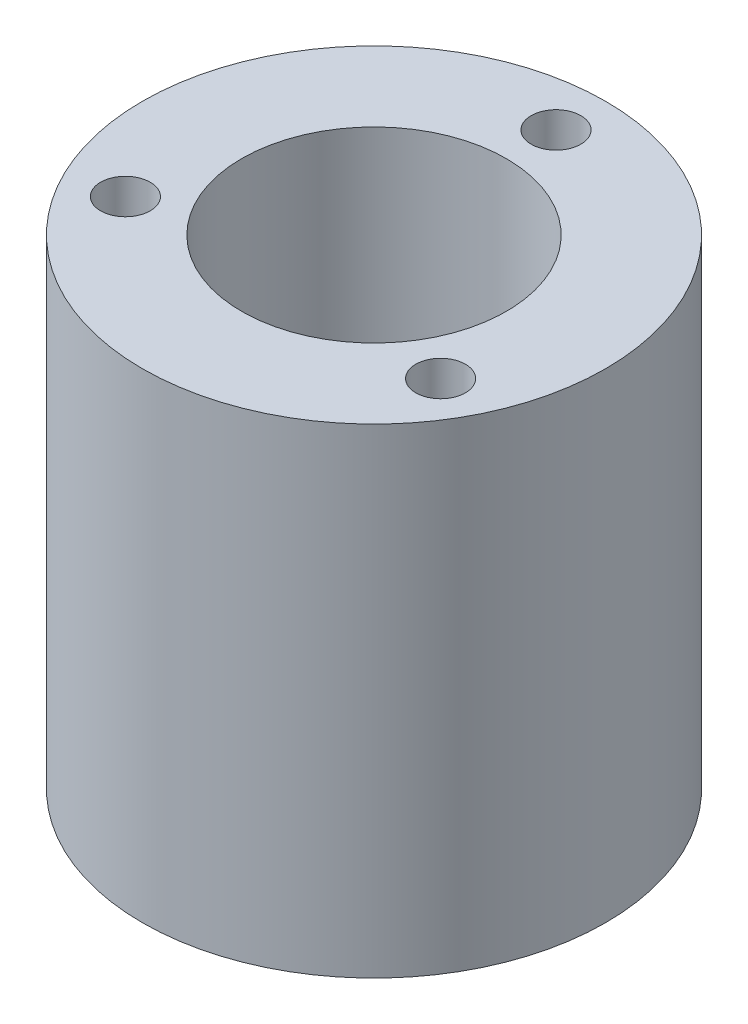
from build123d import *

# Parameters (mm, degrees)
ESQUISSE2_R             = 1.5
ENL_V_MAT_EXTRU_1_DEPTH = 10
ESQUISSE3_R             = 8
ENL_V_MAT_EXTRU_2_DEPTH = 25


with BuildPart() as part:
    # Esquisse1 → Révolution1 (revolve)
    with BuildSketch(Plane.XY):
        Polygon((8, 0), (8, 1.5), (14, 1.5), (14, 30.5), (8, 30.5), (8, 32), (3, 32), (3, 0), align=None)
    revolve(axis=Axis((0, 0, 0), (0, 1, 0)))

    # Esquisse2 → Enlèv. mat.-Extru.1 (cut)
    with BuildSketch(Plane(origin=(0, 30.5, 0), x_dir=(1, 0, 0), z_dir=(0, 1, 0))):
        with Locations((0, 11)):
            Circle(ESQUISSE2_R)
        with Locations((9.526279442, -5.5)):
            Circle(ESQUISSE2_R)
        with Locations((-9.526279442, -5.5)):
            Circle(ESQUISSE2_R)
    extrude(amount=-ENL_V_MAT_EXTRU_1_DEPTH, mode=Mode.SUBTRACT)

    # Esquisse3 → Enlèv. mat.-Extru.2 (cut)
    with BuildSketch(Plane(origin=(0, 32, 0), x_dir=(1, 0, 0), z_dir=(0, 1, 0))):
        Circle(ESQUISSE3_R)
    extrude(amount=-ENL_V_MAT_EXTRU_2_DEPTH, mode=Mode.SUBTRACT)


solid = part.part
